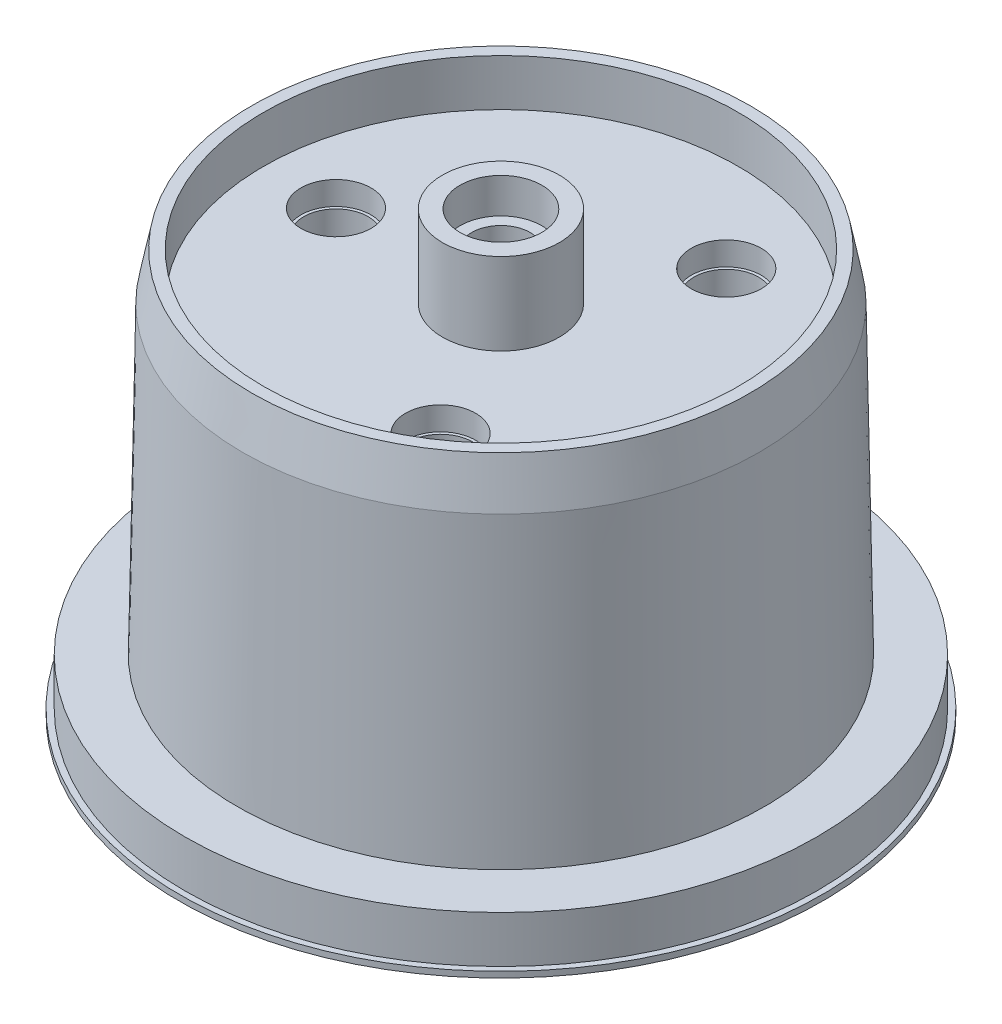
from build123d import *

# Parameters (mm, degrees)
SCHIZZO1_R                    = 22
ESTRUSIONE_ESTRUSIONE1_DEPTH  = 30
SFORMO1_ANGLE                 = 1
SMUSSO1_SIZE                  = 4
SMUSSO1_SIZE2                 = 0.707593191
SCHIZZO2_R                    = 20.292406809
TAGLIO_ESTRUSIONE1_DEPTH      = 4
SCHIZZO4_R                    = 3
TAGLIO_ESTRUSIONE2_DEPTH      = 2
SCHIZZO3_R                    = 5
ESTRUSIONE_ESTRUSIONE2_DEPTH  = 7
SCHIZZO6_R                    = 3.5
TAGLIO_ESTRUSIONE5_DEPTH      = 3
SCHIZZO14_R                   = 27
SCHIZZO14_R_2                 = 22.5
ESTRUSIONE_ESTRUSIONE8_DEPTH  = 4
SCHIZZO16_R                   = 27.5
SCHIZZO16_R_2                 = 26.5
ESTRUSIONE_ESTRUSIONE9_DEPTH  = 0.5
SCHIZZO21_R                   = 22.5
ESTRUSIONE_ESTRUSIONE12_DEPTH = 4
SCHIZZO5_R                    = 2.75
TAGLIO_ESTRUSIONE3_DEPTH      = 49.215661356
RIPETIZIONECIRCOLARE1_COUNT   = 3
SCHIZZO24_R                   = 2.5
TAGLIO_ESTRUSIONE11_DEPTH     = 52.98797938
TAGLIA_RIVOLUZIONE1_ANGLE     = 40
RIVOLUZIONE1_ANGLE            = 2
RIPETIZIONECIRCOLARE2_COUNT   = 6


# Read off the part's stored shape, not the designer's step: Taglia-Rivoluzione1
with BuildPart() as part:
    # Schizzo1 → Estrusione-Estrusione1 (new body)
    with BuildSketch(Plane(origin=(0, 0, 0), x_dir=(1, 0, 0), z_dir=(0, 1, 0))):
        with Locations(Location((0, 0, 0), (0, 0, 270))):
            Circle(SCHIZZO1_R)
    extrude(amount=ESTRUSIONE_ESTRUSIONE1_DEPTH)

    # Sformo1
    sformo1_faces = [part.faces().sort_by_distance(p)[0] for p in [
        (0, 15, -22),
    ]]
    draft(sformo1_faces, Plane.ZX.offset(30), SFORMO1_ANGLE)

    # Smusso1
    smusso1_edges = [part.edges().sort_by_distance(p)[0] for p in [
        (0, 30, -22),
    ]]
    smusso1_side = [part.faces().sort_by_distance(p)[0] for p in [
        (0, 15, -22.261825974),
    ]]
    chamfer(smusso1_edges, length=SMUSSO1_SIZE, length2=SMUSSO1_SIZE2, reference=smusso1_side[0])

    # Schizzo2 → Taglio-Estrusione1 (cut)
    with BuildSketch(Plane(origin=(0, 30, 0), x_dir=(1, 0, 0), z_dir=(0, 1, 0))):
        with Locations(Location((0, 0, 0), (0, 0, 270))):
            Circle(SCHIZZO2_R)
    extrude(amount=-TAGLIO_ESTRUSIONE1_DEPTH, mode=Mode.SUBTRACT)

    # Schizzo4 → Taglio-Estrusione2 (cut)
    with BuildSketch(Plane(origin=(0, 26, 0), x_dir=(1, 0, 0), z_dir=(0, 1, 0))):
        with Locations(Location((7.05, 12.210958193, 0), (0, 0, 270))):
            Circle(SCHIZZO4_R)
    taglio_estrusione2 = extrude(amount=-TAGLIO_ESTRUSIONE2_DEPTH, mode=Mode.SUBTRACT)

    # Schizzo3 → Estrusione-Estrusione2 (add)
    with BuildSketch(Plane(origin=(0, 26, 0), x_dir=(1, 0, 0), z_dir=(0, 1, 0))):
        with Locations(Location((0, 0, 0), (0, 0, 270))):
            Circle(SCHIZZO3_R)
    extrude(amount=ESTRUSIONE_ESTRUSIONE2_DEPTH)

    # Schizzo6 → Taglio-Estrusione5 (cut)
    with BuildSketch(Plane(origin=(0, 33, 0), x_dir=(1, 0, 0), z_dir=(0, 1, 0))):
        with Locations(Location((0, 0, 0), (0, 0, 270))):
            Circle(SCHIZZO6_R)
    extrude(amount=-TAGLIO_ESTRUSIONE5_DEPTH, mode=Mode.SUBTRACT)

    # Schizzo14 → Estrusione-Estrusione8 (add)
    with BuildSketch(Plane.XZ):
        with Locations(Location((0, 0, 0), (0, 0, 270))):
            Circle(SCHIZZO14_R)
        with Locations(Location((0, 0, 0), (0, 0, 270))):
            Circle(SCHIZZO14_R_2, mode=Mode.SUBTRACT)
    extrude(amount=ESTRUSIONE_ESTRUSIONE8_DEPTH)

    # Schizzo16 → Estrusione-Estrusione9 (add)
    with BuildSketch(Plane.XZ.offset(4)):
        with Locations(Location((0, 0, 0), (0, 0, 270))):
            Circle(SCHIZZO16_R)
        with Locations(Location((0, 0, 0), (0, 0, 270))):
            Circle(SCHIZZO16_R_2, mode=Mode.SUBTRACT)
    extrude(amount=ESTRUSIONE_ESTRUSIONE9_DEPTH)

    # Schizzo21 → Estrusione-Estrusione12 (add)
    with BuildSketch(Plane.XZ):
        Circle(SCHIZZO21_R)
    extrude(amount=ESTRUSIONE_ESTRUSIONE12_DEPTH)

    # Schizzo5 → Taglio-Estrusione3 (cut, symmetric)
    with BuildSketch(Plane(origin=(0, 24, 0), x_dir=(1, 0, 0), z_dir=(0, 1, 0))):
        with Locations(Location((7.05, 12.210958193, 0), (0, 0, 270))):
            Circle(SCHIZZO5_R)
    taglio_estrusione3 = extrude(amount=TAGLIO_ESTRUSIONE3_DEPTH, both=True, mode=Mode.SUBTRACT)

    # RipetizioneCircolare1: Taglio-Estrusione2, Taglio-Estrusione3 ×3 about axis
    ripetizionecircolare1_axis = Axis((0, 0, 0), (0, 1, 0))
    add([taglio_estrusione2.rotate(ripetizionecircolare1_axis, i * 360 / RIPETIZIONECIRCOLARE1_COUNT) for i in range(1, RIPETIZIONECIRCOLARE1_COUNT)], mode=Mode.SUBTRACT)
    add([taglio_estrusione3.rotate(ripetizionecircolare1_axis, i * 360 / RIPETIZIONECIRCOLARE1_COUNT) for i in range(1, RIPETIZIONECIRCOLARE1_COUNT)], mode=Mode.SUBTRACT)

    # Schizzo24 → Taglio-Estrusione11 (cut, through all)
    with BuildSketch(Plane(origin=(0, 30, 0), x_dir=(1, 0, 0), z_dir=(0, 1, 0))):
        with Locations(Location((0, 0, 0), (0, 0, 270))):
            Circle(SCHIZZO24_R)
    extrude(amount=-TAGLIO_ESTRUSIONE11_DEPTH, mode=Mode.SUBTRACT)

    # Taglia-Rivoluzione1 outline → Taglia-Rivoluzione1 (revolve, cut)
    with BuildSketch(Plane(origin=(0, 0, 0), x_dir=(0.3420201433256628, 0, -0.9396926207859105), z_dir=(0.9396926207859105, 0, 0.3420201433256628))):
        Polygon((26.5, -4), (21.5, -2), (21.5, -4), align=None)
    taglia_rivoluzione1 = revolve(axis=Axis((0, 0, 0), (0, 1, 0)), revolution_arc=TAGLIA_RIVOLUZIONE1_ANGLE, mode=Mode.SUBTRACT)

    # Schizzo28 → Rivoluzione1 (revolve, symmetric)
    with BuildSketch(Plane(origin=(0, 0, 0), x_dir=(0, 0, -1), z_dir=(1, 0, 0))) as rivoluzione1_sk:
        Polygon((21.5, -4), (21.5, -2), (26.5, -4), align=None)
    rivoluzione1 = revolve(axis=Axis((0, -4.5, 0), (0, 1, 0)), revolution_arc=RIVOLUZIONE1_ANGLE / 2)
    rivoluzione1 = rivoluzione1 + revolve(rivoluzione1_sk.sketch, axis=Axis((0, -4.5, 0), (0, -1, 0)), revolution_arc=RIVOLUZIONE1_ANGLE / 2)

    # RipetizioneCircolare2: Taglia-Rivoluzione1, Rivoluzione1 ×6 about axis
    ripetizionecircolare2_axis = Axis((0, 0, 0), (0, 1, 0))
    add([taglia_rivoluzione1.rotate(ripetizionecircolare2_axis, i * 360 / RIPETIZIONECIRCOLARE2_COUNT) for i in range(1, RIPETIZIONECIRCOLARE2_COUNT)], mode=Mode.SUBTRACT)
    add([rivoluzione1.rotate(ripetizionecircolare2_axis, i * 360 / RIPETIZIONECIRCOLARE2_COUNT) for i in range(1, RIPETIZIONECIRCOLARE2_COUNT)])


solid = part.part
